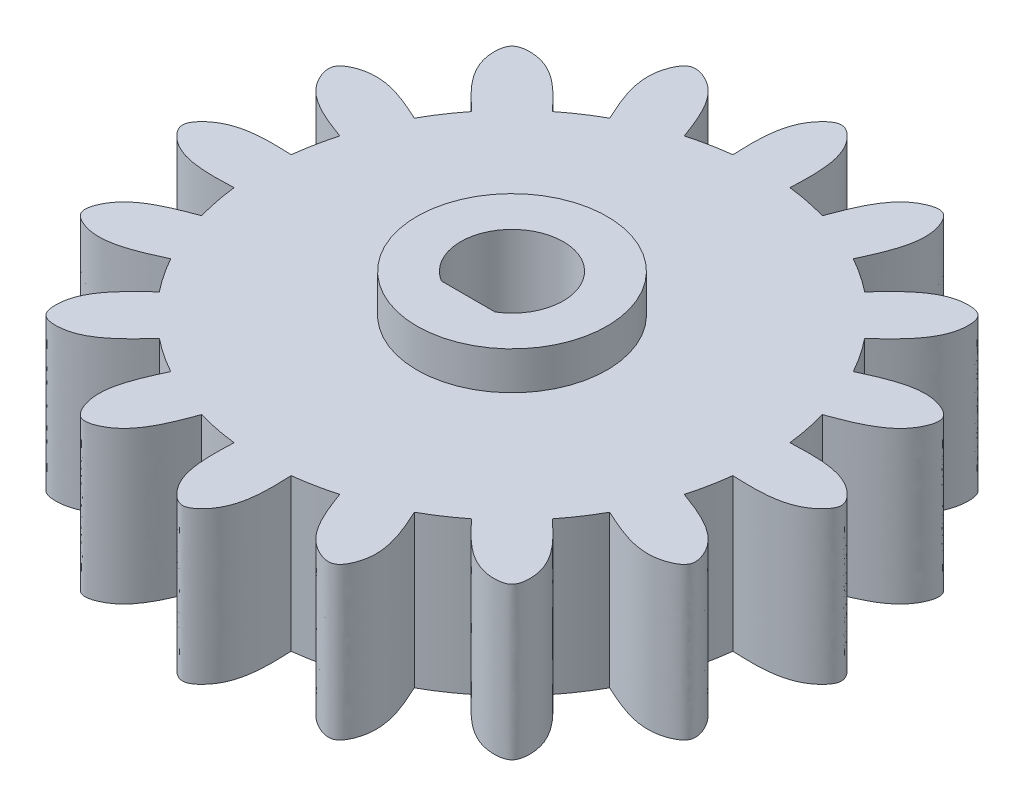
from build123d import *

# Parameters (mm, degrees)
SKETCH1_R           = 13.2
BOSS_EXTRUDE1_DEPTH = 10
SKETCH2_R           = 5
BOSS_EXTRUDE2_DEPTH = 2
BOSS_EXTRUDE5_DEPTH = 10
CIRPATTERN1_COUNT   = 16
CUT_EXTRUDE1_DEPTH  = 28.286884568
SKETCH6_R           = 36.478702283
CUT_EXTRUDE2_DEPTH  = 2


with BuildPart() as part:
    # Sketch1 → Boss-Extrude1 (new body)
    with BuildSketch(Plane(origin=(0, 0, 0), x_dir=(1, 0, 0), z_dir=(0, 1, 0))):
        Circle(SKETCH1_R)
    extrude(amount=BOSS_EXTRUDE1_DEPTH)

    # Sketch2 → Boss-Extrude2 (add)
    with BuildSketch(Plane(origin=(0, 10, 0), x_dir=(1, 0, 0), z_dir=(0, 1, 0))):
        Circle(SKETCH2_R)
    extrude(amount=BOSS_EXTRUDE2_DEPTH)

    # Sketch4 → Boss-Extrude5 (add)
    with BuildSketch(Plane.XZ):
        with BuildLine():
            Line((-1.5, -13.114495797), (1.5, -13.114495797))
            add(Edge.make_bspline(
                [(1.5, -13.114495797), (1.52233311, -13.679701044), (1.574363817, -14.996491562), (1.199302648, -16.609971754), (0, -17.517760626), (-1.199302648, -16.609971754), (-1.574363817, -14.996491562), (-1.52233311, -13.679701044), (-1.5, -13.114495797)],
                knots=[0, 0, 0, 0, 0.178316257, 0.415433434, 0.5, 0.584566566, 0.821683743, 1, 1, 1, 1], degree=3))
        make_face()
    boss_extrude5 = extrude(amount=-BOSS_EXTRUDE5_DEPTH)

    # CirPattern1: Boss-Extrude5 ×16 about axis
    cirpattern1_axis = Axis((0, 0, 0), (0, 1, 0))
    for i in range(1, CIRPATTERN1_COUNT):
        add(boss_extrude5.rotate(cirpattern1_axis, i * 360 / CIRPATTERN1_COUNT))

    # Sketch5 → Cut-Extrude1 (cut, through all)
    with BuildSketch(Plane(origin=(0, 12, 0), x_dir=(1, 0, 0), z_dir=(0, 1, 0))):
        with BuildLine():
            Line((1.414213562, -2.3), (-1.414213562, -2.3))
            ThreePointArc((-1.414213562, -2.3), (0, 2.7), (1.414213562, -2.3))
        make_face()
    extrude(amount=-CUT_EXTRUDE1_DEPTH, mode=Mode.SUBTRACT)

    # Sketch6 → Cut-Extrude2 (cut)
    with BuildSketch(Plane.XZ):
        Circle(SKETCH6_R)
    extrude(amount=-CUT_EXTRUDE2_DEPTH, mode=Mode.SUBTRACT)


solid = part.part
